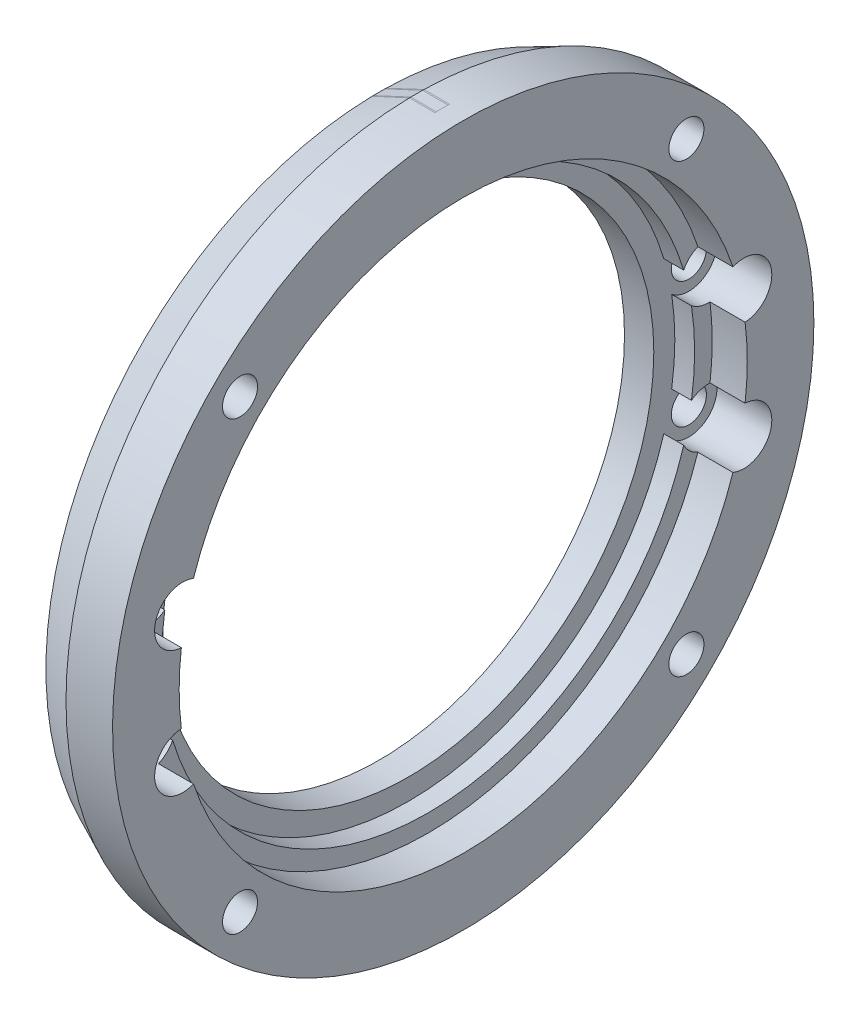
from build123d import *

# Parameters (mm, degrees)
SKETCH1_R           = 35.00000000000001
BOSS_EXTRUDE1_DEPTH = 12
SKETCH2_R           = 38
CUT_EXTRUDE1_DEPTH  = 7.825
SKETCH3_R           = 40.5
CUT_EXTRUDE2_DEPTH  = 5
BOSS_EXTRUDE3_START = -3
SKETCH4_R           = 50.000000000000014
SKETCH4_R_2         = 40.5
BOSS_EXTRUDE3_DEPTH = 3
FILLET1_R           = 10
SKETCH5_R           = 2.5000000000000018
CUT_EXTRUDE3_DEPTH  = 72.72168430816446
CUT_EXTRUDE4_REACH  = 73.722
SKETCH9_R           = 3.999999999999999
CHAMFER2_SIZE       = 2.5
CHAMFER2_SIZE2      = 5.361267301273932
SKETCH10_R          = 2.499999999999999
SKETCH10_R_2        = 2.5000000000000004
SKETCH10_R_3        = 2.5000000000000018
SKETCH10_R_4        = 2.499999999999998
CUT_EXTRUDE5_DEPTH  = 7


with BuildPart() as part:
    # Sketch1 → Boss-Extrude1 (new body)
    with BuildSketch(Plane(origin=(0, 0, 0), x_dir=(0, 0, -1), z_dir=(1, 0, 0))):
        with BuildLine():
            Line((-0.9297857327654514, 49.99135423741935), (0.9297857327657116, 49.99135423741935))
            ThreePointArc((0.9297857327657116, 49.99135423741935), (50, 4.17e-15), (0.9297857327657116, -49.99135423741935))
            Line((0.9297857327657116, -49.99135423741935), (-0.9297857327654514, -49.99135423741935))
            ThreePointArc((-0.9297857327654514, -49.99135423741935), (-50.00000000000001, 1.029e-14), (-0.9297857327654514, 49.99135423741935))
        make_face()
        Circle(SKETCH1_R, mode=Mode.SUBTRACT)
    extrude(amount=BOSS_EXTRUDE1_DEPTH)

    # Sketch2 → Cut-Extrude1 (cut)
    with BuildSketch(Plane(origin=(12, 0, 0), x_dir=(0, 0, -1), z_dir=(1, 0, 0))):
        Circle(SKETCH2_R)
    extrude(amount=-CUT_EXTRUDE1_DEPTH, mode=Mode.SUBTRACT)

    # Sketch3 → Cut-Extrude2 (cut)
    with BuildSketch(Plane(origin=(12, 0, 0), x_dir=(0, 0, -1), z_dir=(1, 0, 0))):
        Circle(SKETCH3_R)
    extrude(amount=-CUT_EXTRUDE2_DEPTH, mode=Mode.SUBTRACT)

    # Sketch4 → Boss-Extrude3 (add)
    with BuildSketch(Plane(origin=(12, 0, 0), x_dir=(0, 0, -1), z_dir=(1, 0, 0)).offset(BOSS_EXTRUDE3_START)):
        with Locations(Location((0, 0, 0), (0, 0, 91.065517382))):
            Circle(SKETCH4_R)
        Circle(SKETCH4_R_2, mode=Mode.SUBTRACT)
    extrude(amount=BOSS_EXTRUDE3_DEPTH)

    # Fillet1
    # the kernel refuses this fillet: 10 mm, written as the material it takes off along each edge
    with BuildSketch(Plane(origin=(-0.2743909200605188, 49.99135423741935, 0.9297857327658466), x_dir=(0, 0, -1), z_dir=(1, 0, 0))) as fillet1_piece_1:
        with BuildLine():
            CenterArc((0.09816907994918522, -10), FILLET1_R, 90, 1.1912889407278016)
            ThreePointArc((-0.10973508325497316, -0.00216144064516044), (-0.05486813470735008, -0.0010506100030554), (0, 0))
            Line((0, 0), (0.09816907994918522, 0))
        make_face()
    extrude(amount=9.27439092006841, mode=Mode.SUBTRACT)
    with BuildSketch(Plane(origin=(-0.27439092006290455, 49.99135423741935, -0.9297857327660938), x_dir=(0, 0, 1), z_dir=(1, 0, 0))) as fillet1_piece_2:
        with BuildLine():
            CenterArc((0.09816907994990931, 10), FILLET1_R, 268.80871105927287, 1.1912889407271336)
            ThreePointArc((-0.10973508325413761, 0.00216144064516044), (-0.05486813470693486, 0.0010506100030554), (0, 0))
            Line((0, 0), (0.09816907994990931, 0))
        make_face()
    extrude(amount=9.274390920070795, mode=Mode.SUBTRACT)
    with BuildSketch(Plane(origin=(-0.27439092006166854, -49.991354237419344, -0.9297857327653347), x_dir=(0, 0.019693077349376736, -0.9998060725483275), z_dir=(1, 0, 0))) as fillet1_piece_3:
        with BuildLine():
            CenterArc((0.09878073122404785, 9.999993976768026), FILLET1_R, 268.8715968385298, 1.19128894072702)
            Line((-0.09815004226971198, 0.00193325128475002), (0, 0))
            ThreePointArc((0, 0), (0.05487818401377818, -3.011615987851e-05), (0.10975636802755673, 0))
        make_face()
    extrude(amount=9.274390920069559, mode=Mode.SUBTRACT)
    with BuildSketch(Plane(origin=(-0.27439092005998433, -49.991354237419344, 0.9297857327658335), x_dir=(0, 0.019693077349452987, 0.999806072548326), z_dir=(1, 0, 0))) as fillet1_piece_4:
        with BuildLine():
            CenterArc((0.09878073122379578, -9.999993976768023), FILLET1_R, 89.93711422074833, 1.191288940726281)
            Line((-0.09815004227073397, -0.00193325128476343), (0, 0))
            ThreePointArc((0, 0), (0.05487818401320508, 3.011615987141e-05), (0.10975636802641013, 0))
        make_face()
    extrude(amount=9.274390920067875, mode=Mode.SUBTRACT)

    # Sketch5 → Cut-Extrude3 (cut, through all)
    with BuildSketch(Plane(origin=(12, 0, 0), x_dir=(0, 0, -1), z_dir=(1, 0, 0))):
        with Locations((39.999999999999986, 9.000000000000002)):
            Circle(SKETCH5_R)
        with Locations((39.999999999999986, -8.999999999999998)):
            Circle(SKETCH5_R)
        with Locations((-40.000000000000014, -8.999999999999998)):
            Circle(SKETCH5_R)
        with Locations((-40.000000000000014, 8.999999999999998)):
            Circle(SKETCH5_R)
    extrude(amount=-CUT_EXTRUDE3_DEPTH, mode=Mode.SUBTRACT)

    # Cut-Extrude4: up to this face of the body (flat: up to its plane)
    cut_extrude4_end = Plane(part.part.faces().sort_by_distance((4.175, 0, 36.925197693))[0])
    # Sketch9 → Cut-Extrude4 (cut, up to the picked face)
    with BuildSketch(Plane(origin=(12, 0, 0), x_dir=(0, 0, -1), z_dir=(1, 0, 0)), mode=Mode.PRIVATE) as cut_extrude4_sk1:
        with Locations((-40.000000000000014, 8.999999999999998)):
            Circle(SKETCH9_R)
    cut_extrude4_tool1 = split(extrude(cut_extrude4_sk1.sketch, amount=-CUT_EXTRUDE4_REACH, mode=Mode.PRIVATE), bisect_by=cut_extrude4_end, keep=Keep.BOTH, mode=Mode.PRIVATE)
    # Sketch9 → Cut-Extrude4 (cut, up to the picked face)
    with BuildSketch(Plane(origin=(12, 0, 0), x_dir=(0, 0, -1), z_dir=(1, 0, 0)), mode=Mode.PRIVATE) as cut_extrude4_sk2:
        with Locations((-40.000000000000014, -8.999999999999998)):
            Circle(SKETCH9_R)
    cut_extrude4_tool2 = split(extrude(cut_extrude4_sk2.sketch, amount=-CUT_EXTRUDE4_REACH, mode=Mode.PRIVATE), bisect_by=cut_extrude4_end, keep=Keep.BOTH, mode=Mode.PRIVATE)
    # Sketch9 → Cut-Extrude4 (cut, up to the picked face)
    with BuildSketch(Plane(origin=(12, 0, 0), x_dir=(0, 0, -1), z_dir=(1, 0, 0)), mode=Mode.PRIVATE) as cut_extrude4_sk3:
        with Locations((39.999999999999986, -8.999999999999998)):
            Circle(SKETCH9_R)
    cut_extrude4_tool3 = split(extrude(cut_extrude4_sk3.sketch, amount=-CUT_EXTRUDE4_REACH, mode=Mode.PRIVATE), bisect_by=cut_extrude4_end, keep=Keep.BOTH, mode=Mode.PRIVATE)
    # Sketch9 → Cut-Extrude4 (cut, up to the picked face)
    with BuildSketch(Plane(origin=(12, 0, 0), x_dir=(0, 0, -1), z_dir=(1, 0, 0)), mode=Mode.PRIVATE) as cut_extrude4_sk4:
        with Locations((39.999999999999986, 8.999999999999998)):
            Circle(SKETCH9_R)
    cut_extrude4_tool4 = split(extrude(cut_extrude4_sk4.sketch, amount=-CUT_EXTRUDE4_REACH, mode=Mode.PRIVATE), bisect_by=cut_extrude4_end, keep=Keep.BOTH, mode=Mode.PRIVATE)
    add(cut_extrude4_tool1.solids().sort_by(Axis((12, 9, 40), (-1, 0, 0)))[0], mode=Mode.SUBTRACT)
    add(cut_extrude4_tool2.solids().sort_by(Axis((12, -9, 40), (-1, 0, 0)))[0], mode=Mode.SUBTRACT)
    add(cut_extrude4_tool3.solids().sort_by(Axis((12, -9, -40), (-1, 0, 0)))[0], mode=Mode.SUBTRACT)
    add(cut_extrude4_tool4.solids().sort_by(Axis((12, 9, -40), (-1, 0, 0)))[0], mode=Mode.SUBTRACT)

    # Chamfer2
    chamfer2_edges = [part.edges().sort_by_distance(p)[0] for p in [
        (0, 4.163e-14, 50.000000000000014),
        (0, 8.2534e-13, -50),
        (0, 49.99135423741935, 4.9938e-13),
        (0, -49.99135423741935, 7.583e-14),
        (0, -49.99081386265752, 0.9355743520296814),
        (0, -49.990813862657504, -0.9355743520294721),
        (0, 49.99081386265747, -0.9355743520297026),
        (0, 49.99081386265747, 0.9355743520307873),
    ]]
    chamfer2_side = [part.faces().sort_by_distance(p)[0] for p in [
        (0, -48.576798978470165, -0.920873784247004),
    ]]
    chamfer(chamfer2_edges, length=CHAMFER2_SIZE, length2=CHAMFER2_SIZE2, reference=chamfer2_side[0])

    # Sketch10 → Cut-Extrude5 (cut)
    with BuildSketch(Plane(origin=(12, 0, 0), x_dir=(0, 0, -1), z_dir=(1, 0, 0))):
        with Locations((-31.819805153394583, 31.819805153394686)):
            Circle(SKETCH10_R)
        with Locations((31.819805153394796, 31.81980515339447)):
            Circle(SKETCH10_R_2)
        with Locations((31.81980515339436, -31.819805153394906)):
            Circle(SKETCH10_R_3)
        with Locations((-31.81980515339502, -31.81980515339425)):
            Circle(SKETCH10_R_4)
    extrude(amount=-CUT_EXTRUDE5_DEPTH, mode=Mode.SUBTRACT)


solid = part.part
